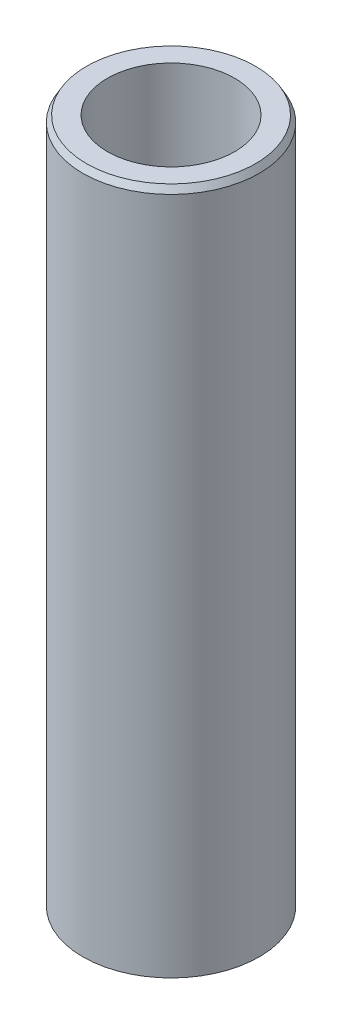
from build123d import *
from OCP.BRepFilletAPI import BRepFilletAPI_MakeChamfer

# Parameters (mm, degrees)
SKETCH1_R           = 37.5
BOSS_EXTRUDE1_DEPTH = 292.768463466
SKETCH2_R           = 27.058833909
CUT_EXTRUDE1_DEPTH  = 298.53297834
CHAMFER1_SIZE       = 2.753073049
CHAMFER1_SIZE2      = 1.589487466


with BuildPart() as part:
    # Sketch1 → Boss-Extrude1 (new body)
    with BuildSketch(Plane(origin=(0, 0, 0), x_dir=(1, 0, 0), z_dir=(0, 1, 0))):
        Circle(SKETCH1_R)
    extrude(amount=BOSS_EXTRUDE1_DEPTH)

    # Sketch2 → Cut-Extrude1 (cut, through all)
    with BuildSketch(Plane(origin=(0, 0, 0), x_dir=(1, 0, 0), z_dir=(0, 1, 0))):
        Circle(SKETCH2_R)
    extrude(amount=CUT_EXTRUDE1_DEPTH, mode=Mode.SUBTRACT)

    # Chamfer1: one chamfer whose edges measure the first distance from different faces: ONE call of the kernel's chamfer builder (chamfer() names one face for all edges)
    chamfer1_edges_1 = [part.edges().sort_by_distance(p)[0] for p in [
        (-37.5, 292.768463466, 0),
    ]]
    chamfer1_side_1 = [part.faces().sort_by_distance(p)[0] for p in [
        (-37.5, 146.384231733, 0),
    ]]
    chamfer1_edges_2 = [part.edges().sort_by_distance(p)[0] for p in [
        (-37.5, 0, 0),
    ]]
    chamfer1_side_2 = [part.faces().sort_by_distance(p)[0] for p in [
        (-36.439339828, 0, 0),
    ]]
    chamfer1 = BRepFilletAPI_MakeChamfer(part.part.solid().wrapped)
    for e in chamfer1_edges_1:
        chamfer1.Add(CHAMFER1_SIZE, CHAMFER1_SIZE2, e.wrapped, chamfer1_side_1[0].wrapped)  # the first distance lies on this face
    for e in chamfer1_edges_2:
        chamfer1.Add(CHAMFER1_SIZE, CHAMFER1_SIZE2, e.wrapped, chamfer1_side_2[0].wrapped)  # the first distance lies on this face
    add(Compound.cast(chamfer1.Shape()), mode=Mode.REPLACE)


solid = part.part
